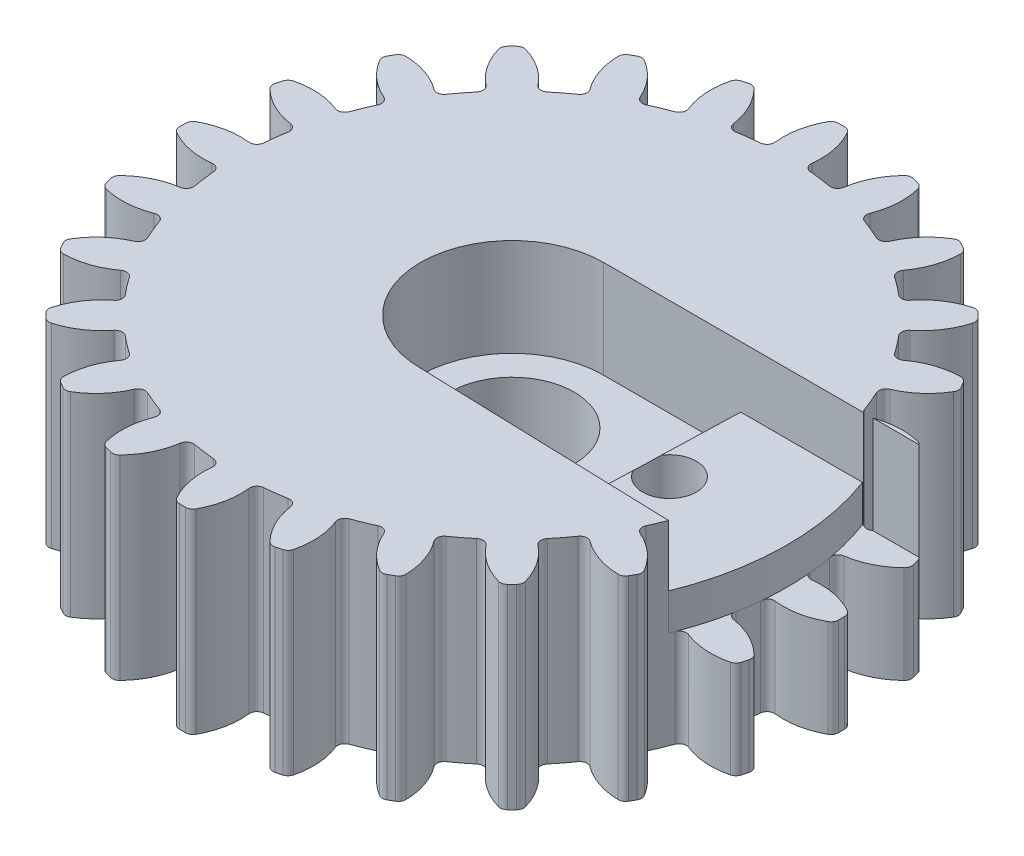
from build123d import *

# Parameters (mm, degrees)
SKETCH2_R           = 2.55
BOSS_EXTRUDE1_DEPTH = 8
BOSS_EXTRUDE2_DEPTH = 8
CIRPATTERN2_COUNT   = 24
FILLET1_R           = 0.3
SKETCH3_R           = 1.1
CUT_EXTRUDE1_DEPTH  = 10
CUT_EXTRUDE2_DEPTH  = 4
BOSS_EXTRUDE3_DEPTH = 1.5
CHAMFER1_SIZE       = 1.5
SKETCH3_2_R         = 1.1
CUT_EXTRUDE3_DEPTH  = 10


with BuildPart() as part:
    # Sketch2 → Boss-Extrude1 (new body)
    with BuildSketch(Plane(origin=(0, 0, 0), x_dir=(1, 0, 0), z_dir=(0, 1, 0))):
        with BuildLine():
            ThreePointArc((11.25, 0), (8.198704166, 7.703489469), (0.7, 11.228201103))
            ThreePointArc((0.7, 11.228201103), (0, 11.25), (-0.7, 11.228201103))
            ThreePointArc((-0.7, 11.228201103), (-7.703489469, -8.198704166), (11.25, 0))
        make_face()
        with Locations(Location((0, 0, 0), (0, 0, 270))):
            Circle(SKETCH2_R, mode=Mode.SUBTRACT)
    extrude(amount=BOSS_EXTRUDE1_DEPTH)

    # Sketch2<5> → Boss-Extrude2 (add)
    with BuildSketch(Plane(origin=(0, 0, 0), x_dir=(1, 0, 0), z_dir=(0, 1, 0))):
        with BuildLine():
            ThreePointArc((0.7, 11.228201103), (0.72727513, 12.40411732), (0.3, 13.5))
            Line((0.3, 13.5), (-0.3, 13.5))
            ThreePointArc((-0.3, 13.5), (-0.72727513, 12.40411732), (-0.7, 11.228201103))
            ThreePointArc((-0.7, 11.228201103), (0, 11.25), (0.7, 11.228201103))
        make_face()
    boss_extrude2 = extrude(amount=BOSS_EXTRUDE2_DEPTH)

    # CirPattern2: Boss-Extrude2 ×24 about axis
    cirpattern2_axis = Axis((0, 0, 0), (0, 1, 0))
    for i in range(1, CIRPATTERN2_COUNT):
        add(boss_extrude2.rotate(cirpattern2_axis, i * 360 / CIRPATTERN2_COUNT))

    # Fillet1
    fillet1_edges = [part.edges().sort_by_distance(p)[0] for p in [
        (5.007882769, 4, 10.073907394),
        (6.490192379, 4, 11.841342951),
        (7.009807621, 4, 11.541342951),
        (6.220318334, 4, 9.373907394),
        (2.229924209, 4, 11.026782759),
        (3.204279361, 4, 13.117644368),
        (3.783834857, 4, 12.962352941),
        (3.582220366, 4, 10.664436096),
        (-0.7, 4, 11.228201103),
        (-0.3, 4, 13.5),
        (0.3, 4, 13.5),
        (0.7, 4, 11.228201103),
        (0.7, 4, -11.228201103),
        (-3.582220366, 4, 10.664436096),
        (-3.783834857, 4, 12.962352941),
        (0.3, 4, -13.5),
        (-3.204279361, 4, 13.117644368),
        (-2.229924209, 4, 11.026782759),
        (-0.3, 4, -13.5),
        (-6.220318334, 4, 9.373907394),
        (-7.009807621, 4, 11.541342951),
        (-6.490192379, 4, 11.841342951),
        (-5.007882769, 4, 10.073907394),
        (-0.7, 4, -11.228201103),
        (-8.434511887, 4, 7.444562393),
        (-9.75807358, 4, 9.333809512),
        (-9.333809512, 4, 9.75807358),
        (-7.444562393, 4, 8.434511887),
        (-10.073907394, 4, 5.007882769),
        (-11.841342951, 4, 6.490192379),
        (-11.541342951, 4, 7.009807621),
        (-9.373907394, 4, 6.220318334),
        (-11.026782759, 4, 2.229924209),
        (-13.117644368, 4, 3.204279361),
        (-12.962352941, 4, 3.783834857),
        (-10.664436096, 4, 3.582220366),
        (-11.228201103, 4, -0.7),
        (-13.5, 4, -0.3),
        (-13.5, 4, 0.3),
        (-11.228201103, 4, 0.7),
        (-10.664436096, 4, -3.582220366),
        (-12.962352941, 4, -3.783834857),
        (-13.117644368, 4, -3.204279361),
        (-11.026782759, 4, -2.229924209),
        (-9.373907394, 4, -6.220318334),
        (-11.541342951, 4, -7.009807621),
        (-11.841342951, 4, -6.490192379),
        (-10.073907394, 4, -5.007882769),
        (-7.444562393, 4, -8.434511887),
        (-9.333809512, 4, -9.75807358),
        (-9.75807358, 4, -9.333809512),
        (-8.434511887, 4, -7.444562393),
        (-5.007882769, 4, -10.073907394),
        (-6.490192379, 4, -11.841342951),
        (-7.009807621, 4, -11.541342951),
        (-6.220318334, 4, -9.373907394),
        (11.228201103, 4, 0.7),
        (13.5, 4, 0.3),
        (13.5, 4, -0.3),
        (11.228201103, 4, -0.7),
        (11.026782759, 4, -2.229924209),
        (13.117644368, 4, -3.204279361),
        (12.962352941, 4, -3.783834857),
        (10.664436096, 4, -3.582220366),
        (10.073907394, 4, -5.007882769),
        (11.841342951, 4, -6.490192379),
        (11.541342951, 4, -7.009807621),
        (9.373907394, 4, -6.220318334),
        (8.434511887, 4, -7.444562393),
        (9.75807358, 4, -9.333809512),
        (9.333809512, 4, -9.75807358),
        (7.444562393, 4, -8.434511887),
        (6.220318334, 4, -9.373907394),
        (7.009807621, 4, -11.541342951),
        (6.490192379, 4, -11.841342951),
        (5.007882769, 4, -10.073907394),
        (3.582220366, 4, -10.664436096),
        (3.783834857, 4, -12.962352941),
        (3.204279361, 4, -13.117644368),
        (2.229924209, 4, -11.026782759),
        (-2.229924209, 4, -11.026782759),
        (-3.204279361, 4, -13.117644368),
        (-3.783834857, 4, -12.962352941),
        (-3.582220366, 4, -10.664436096),
        (10.664436096, 4, 3.582220366),
        (12.962352941, 4, 3.783834857),
        (13.117644368, 4, 3.204279361),
        (11.026782759, 4, 2.229924209),
        (9.373907394, 4, 6.220318334),
        (11.541342951, 4, 7.009807621),
        (11.841342951, 4, 6.490192379),
        (10.073907394, 4, 5.007882769),
        (7.444562393, 4, 8.434511887),
        (9.333809512, 4, 9.75807358),
        (9.75807358, 4, 9.333809512),
        (8.434511887, 4, 7.444562393),
    ]]
    fillet(fillet1_edges, radius=FILLET1_R)

    # Sketch3 → Cut-Extrude1 (cut)
    with BuildSketch(Plane(origin=(0, 8, 0), x_dir=(1, 0, 0), z_dir=(0, 1, 0))):
        with Locations(Location((6.45, 0, 0), (0, 0, 270))):
            Circle(SKETCH3_R)
    extrude(amount=-CUT_EXTRUDE1_DEPTH, mode=Mode.SUBTRACT)

    # Sketch4 → Cut-Extrude2 (cut)
    with BuildSketch(Plane(origin=(0, 8, 0), x_dir=(1, 0, 0), z_dir=(0, 1, 0))):
        with BuildLine():
            Line((0, 3.75), (16.248499211, 3.75))
            Line((16.248499211, 3.75), (16.248499211, -4.25))
            Line((16.248499211, -4.25), (0, -3.75))
            ThreePointArc((0, -3.75), (-3.75, 0), (0, 3.75))
        make_face()
    extrude(amount=-CUT_EXTRUDE2_DEPTH, mode=Mode.SUBTRACT)

    # Sketch5 → Boss-Extrude3 (add)
    with BuildSketch(Plane(origin=(0, 4, 0), x_dir=(1, 0, 0), z_dir=(0, 1, 0))):
        with BuildLine():
            Line((10.556810492, 3.887962479), (4.120575018, 3.75))
            Line((4.120575018, 3.75), (3.88610464, -3.869583495))
            Line((3.88610464, -3.869583495), (10.486924188, -4.072704394))
            ThreePointArc((10.486924188, -4.072704394), (11.2859366, -0.099078684), (10.556810492, 3.887962479))
        make_face()
    extrude(amount=BOSS_EXTRUDE3_DEPTH)

    # Chamfer1
    chamfer1_edges = [part.edges().sort_by_distance(p)[0] for p in [
        (4.003339829, 5.5, 0.059791747),
    ]]
    chamfer(chamfer1_edges, length=CHAMFER1_SIZE - 0.0001)  # a hair under: the kernel refuses the full size

    # Sketch3<2> → Cut-Extrude3 (cut)
    with BuildSketch(Plane(origin=(0, 8, 0), x_dir=(1, 0, 0), z_dir=(0, 1, 0))):
        with Locations(Location((6.45, 0, 0), (0, 0, 270))):
            Circle(SKETCH3_2_R)
    extrude(amount=-CUT_EXTRUDE3_DEPTH, mode=Mode.SUBTRACT)


solid = part.part
